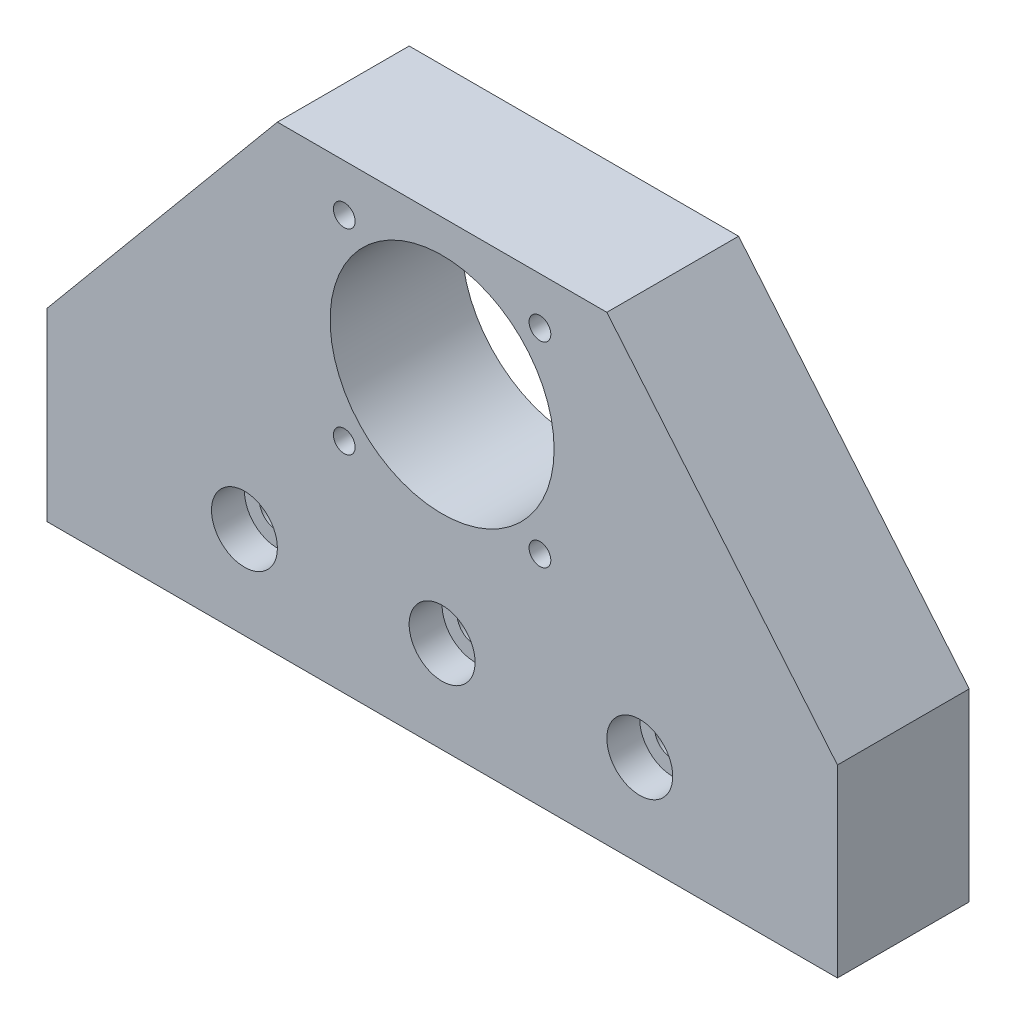
from build123d import *

# Parameters (mm, degrees)
BOSS_EXTRUDE1_DEPTH            = 20
CBORE_FOR_M5_SHCS1_D           = 5.5
CBORE_FOR_M5_SHCS1_CBORE_D     = 10
CBORE_FOR_M5_SHCS1_CBORE_DEPTH = 5
SKETCH4_R                      = 17
CUT_EXTRUDE1_DEPTH             = 95.339811321
M4_TAPPED_HOLE1_D              = 3.3
M4_TAPPED_HOLE2_D              = 3.3
M4_TAPPED_HOLE2_DEPTH          = 15
M4_TAPPED_HOLE2_TIP            = 0.991420021


with BuildPart() as part:
    # Sketch1 → Boss-Extrude1 (new body)
    with BuildSketch(Plane.XY):
        Polygon((60, 0), (-60, 0), (-60, 28), (-25, 70), (25, 70), (60, 28), align=None)
    extrude(amount=BOSS_EXTRUDE1_DEPTH)

    # CBORE for M5 SHCS1 (through all)
    with Locations(Plane(origin=(-30, 14, 20), x_dir=(1, 0, 0), z_dir=(0, 0, 1))):
        with Locations((0, 0), (30, 0), (60, 0)):
            CounterBoreHole(CBORE_FOR_M5_SHCS1_D / 2, CBORE_FOR_M5_SHCS1_CBORE_D / 2, CBORE_FOR_M5_SHCS1_CBORE_DEPTH)

    # Sketch4 → Cut-Extrude1 (cut, through all)
    with BuildSketch(Plane.XY.offset(20)):
        with Locations((0, 48)):
            Circle(SKETCH4_R)
    extrude(amount=-CUT_EXTRUDE1_DEPTH, mode=Mode.SUBTRACT)

    # M4 Tapped Hole1 (through all)
    with Locations(Plane(origin=(-14.849242405, 62.849242405, 20), x_dir=(1, 0, 0), z_dir=(0, 0, 1))):
        with Locations((0, 0), (29.69848481, 0), (29.69848481, -29.69848481), (0, -29.69848481)):
            Hole(M4_TAPPED_HOLE1_D / 2)

    # M4 Tapped Hole2
    with Locations(Plane(origin=(0, 0, 0), x_dir=(-1, 0, 0), z_dir=(0, -1, 0))):
        with Locations((20.1, -10), (-20.1, -10)):
            Hole(M4_TAPPED_HOLE2_D / 2, depth=M4_TAPPED_HOLE2_DEPTH)
            with Locations((0, 0, -(M4_TAPPED_HOLE2_DEPTH + M4_TAPPED_HOLE2_TIP / 2))):  # 118° drill point
                Cone(0, M4_TAPPED_HOLE2_D / 2, M4_TAPPED_HOLE2_TIP, mode=Mode.SUBTRACT)


solid = part.part
